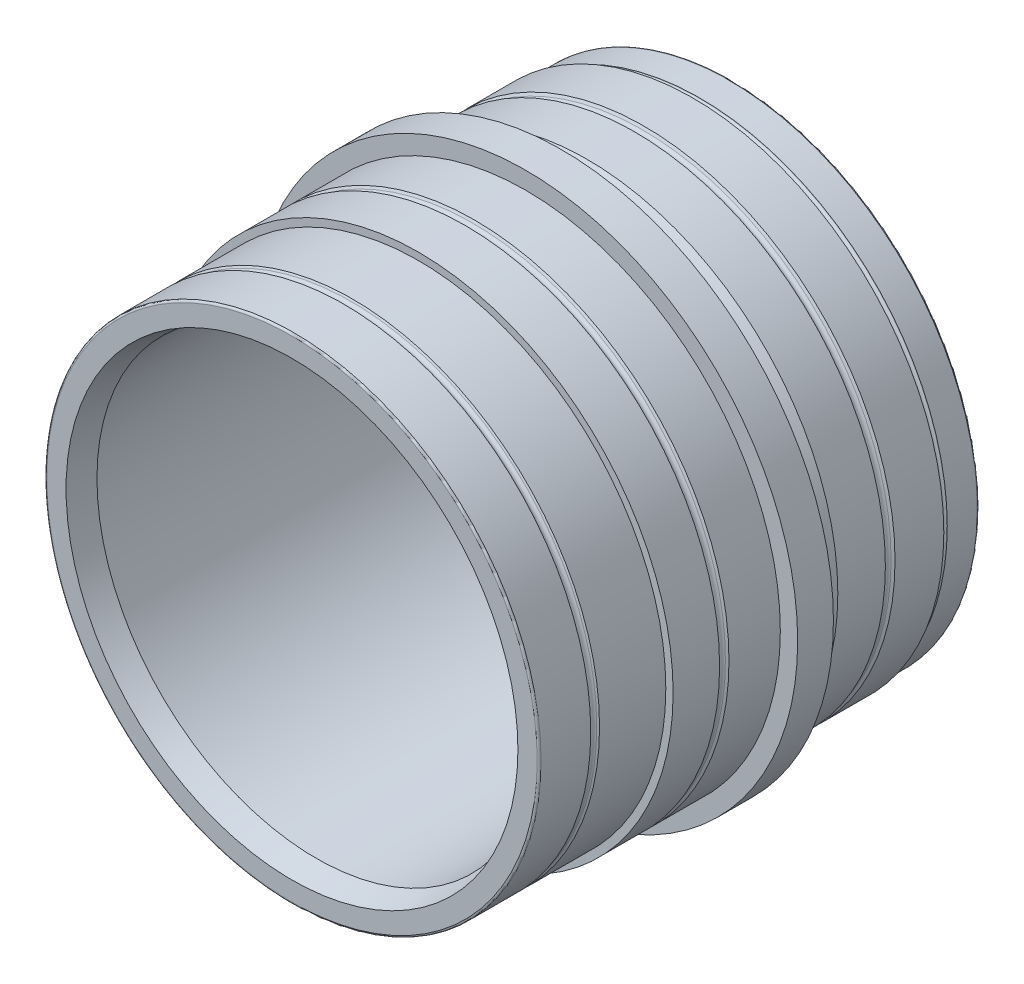
from build123d import *


with BuildPart() as part:
    # Sketch1 → Revolve1 (revolve)
    with BuildSketch(Plane(origin=(0, 0, 0), x_dir=(0, 0, -1), z_dir=(1, 0, 0))):
        with BuildLine():
            Line((0, 23.182372981), (2.5, 22.5125))
            Line((2.5, 22.5125), (42.65, 22.5125))
            Line((42.65, 22.5125), (45.15, 23.182372981))
            Line((45.15, 23.182372981), (45.15, 25.1575))
            ThreePointArc((45.15, 25.1575), (45.091421356, 25.298921356), (44.95, 25.3575))
            Line((44.95, 25.3575), (41.880348091, 25.3575))
            Line((41.880348091, 25.3575), (41.861584207, 25.325))
            ThreePointArc((41.861584207, 25.325), (41.515174045, 25.125), (41.168763884, 25.325))
            Line((41.168763884, 25.325), (41.15, 25.3575))
            Line((41.15, 25.3575), (41.15, 25.7325))
            Line((41.15, 25.7325), (36.145077856, 25.7325))
            Line((36.145077856, 25.7325), (35.996410162, 25.475))
            ThreePointArc((35.996410162, 25.475), (35.65, 25.275), (35.303589838, 25.475))
            Line((35.303589838, 25.475), (35.154922144, 25.7325))
            Line((35.154922144, 25.7325), (30.275, 25.7325))
            Line((30.275, 25.7325), (29.313996917, 25.475))
            Line((29.313996917, 25.475), (28.775, 25.475))
            ThreePointArc((28.775, 25.475), (28.421446609, 25.621446609), (28.275, 25.975))
            Line((28.275, 25.975), (28.275, 26.8375))
            Line((28.275, 26.8375), (27.668782217, 27.8875))
            Line((27.668782217, 27.8875), (24, 27.8875))
            Line((24, 27.8875), (24, 26.1075))
            Line((24, 26.1075), (18.730644099, 26.1075))
            Line((18.730644099, 26.1075), (18.596410162, 25.875))
            ThreePointArc((18.596410162, 25.875), (18.25, 25.675), (17.903589838, 25.875))
            Line((17.903589838, 25.875), (17.769355901, 26.1075))
            Line((17.769355901, 26.1075), (13, 26.1075))
            Line((13, 26.1075), (13, 25.3575))
            Line((13, 25.3575), (6.201776586, 25.3575))
            Line((6.201776586, 25.3575), (6.096410162, 25.175))
            ThreePointArc((6.096410162, 25.175), (5.75, 24.975), (5.403589838, 25.175))
            Line((5.403589838, 25.175), (5.298223414, 25.3575))
            Line((5.298223414, 25.3575), (0.2, 25.3575))
            ThreePointArc((0.2, 25.3575), (0.058578644, 25.298921356), (0, 25.1575))
            Line((0, 25.1575), (0, 23.182372981))
        make_face()
    revolve(axis=Axis((0, 0, 0), (0, 0, -1)))


solid = part.part
